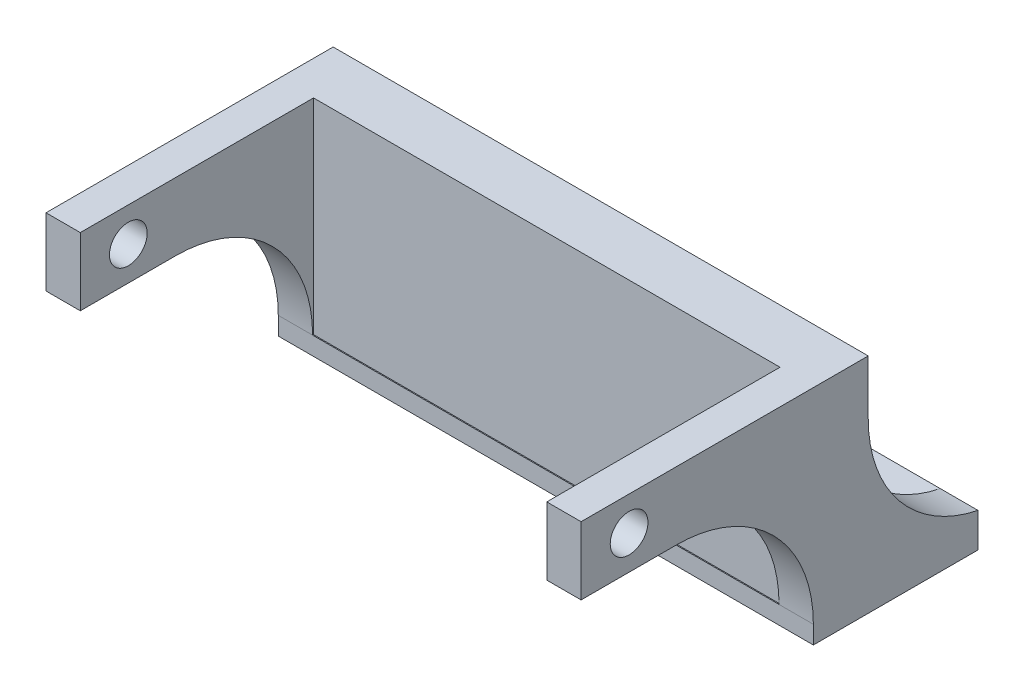
from build123d import *

# Parameters (mm, degrees)
SKETCH1_W           = 78
SKETCH1_H           = 24
BOSS_EXTRUDE1_DEPTH = 5
SKETCH2_W           = 78
SKETCH2_H           = 8
BOSS_EXTRUDE2_DEPTH = 27.5
FILLET1_R           = 20
SKETCH3_W           = 67
SKETCH3_H           = 19.595917942
CUT_EXTRUDE1_DEPTH  = 16
SKETCH4_W           = 33.86
SKETCH4_H           = 9.88
SKETCH4_R           = 2.75
BOSS_EXTRUDE3_DEPTH = 78
FILLET2_R           = 20
SKETCH5_W           = 68
SKETCH5_H           = 20
CUT_EXTRUDE2_DEPTH  = 34
SKETCH6_W           = 68
SKETCH6_H           = 9.88
CUT_EXTRUDE3_DEPTH  = 34


with BuildPart() as part:
    # Sketch1 → Boss-Extrude1 (new body)
    with BuildSketch(Plane(origin=(0, 0, 0), x_dir=(1, 0, 0), z_dir=(0, 1, 0))):
        Rectangle(SKETCH1_W, SKETCH1_H)
    extrude(amount=BOSS_EXTRUDE1_DEPTH)

    # Sketch2 → Boss-Extrude2 (add)
    with BuildSketch(Plane(origin=(0, 5, 0), x_dir=(1, 0, 0), z_dir=(0, 1, 0))):
        with Locations((0, -8)):
            Rectangle(SKETCH2_W, SKETCH2_H)
    extrude(amount=BOSS_EXTRUDE2_DEPTH)

    # Fillet1
    # the kernel refuses this fillet: 20 mm, written as the material it adds along each edge
    with BuildSketch(Plane(origin=(39, 5, 4), x_dir=(0, 0, -1), z_dir=(-1, 0, 0))) as fillet1_piece_1:
        with BuildLine():
            CenterArc((20, -19.595917942), FILLET1_R, 101.536959033, 78.463040967)
            Line((0, -19.595917942), (-0.4, -19.595917942))
            Line((-0.4, -19.595917942), (-0.4, 0))
            Line((-0.4, 0), (0, 0.4))
            ThreePointArc((0, 0.4), (8, 0.4), (15.92, 0.391918359))
            Line((15.92, 0.391918359), (16, 0))
        make_face()
    extrude(amount=78)

    # Sketch3 → Cut-Extrude1 (cut)
    with BuildSketch(Plane(origin=(0, 0, -12), x_dir=(-1, 0, 0), z_dir=(0, 0, -1))):
        with Locations((0, 14.797958971)):
            Rectangle(SKETCH3_W, SKETCH3_H)
    extrude(amount=-CUT_EXTRUDE1_DEPTH, mode=Mode.SUBTRACT)

    # Sketch4 → Boss-Extrude3 (add)
    with BuildSketch(Plane.ZY.offset(39)):
        with Locations((28.93, 27.56)):
            Rectangle(SKETCH4_W, SKETCH4_H)
        with Locations((38.86, 27.56)):
            Circle(SKETCH4_R, mode=Mode.SUBTRACT)
    extrude(amount=-BOSS_EXTRUDE3_DEPTH)

    # Fillet2
    fillet2_edges = [part.edges().sort_by_distance(p)[0] for p in [
        (0, 22.62, 12),
    ]]
    fillet(fillet2_edges, radius=FILLET2_R)

    # Sketch5 → Cut-Extrude2 (cut)
    with BuildSketch(Plane.XY.offset(45.86)):
        with Locations((0, 12.62)):
            Rectangle(SKETCH5_W, SKETCH5_H)
    extrude(amount=-CUT_EXTRUDE2_DEPTH, mode=Mode.SUBTRACT)

    # Sketch6 → Cut-Extrude3 (cut)
    with BuildSketch(Plane.XY.offset(45.86)):
        with Locations((0, 27.56)):
            Rectangle(SKETCH6_W, SKETCH6_H)
    extrude(amount=-CUT_EXTRUDE3_DEPTH, mode=Mode.SUBTRACT)


solid = part.part
